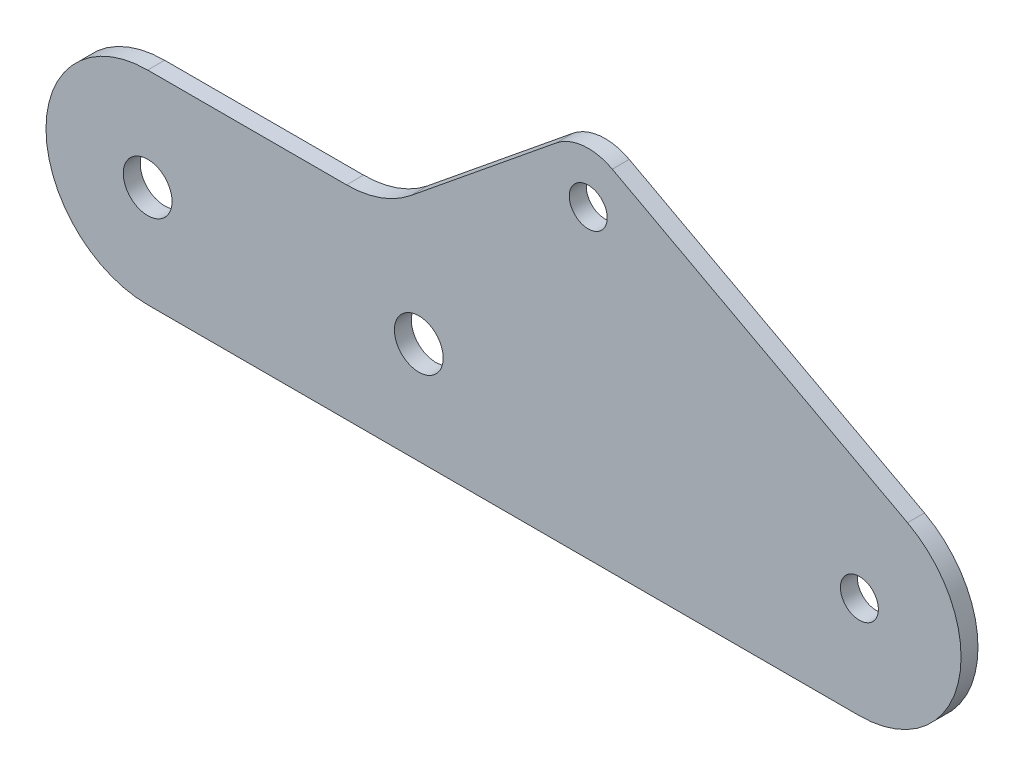
from build123d import *

# Parameters (mm, degrees)
SKETCH1_R           = 2.286
SKETCH1_R_2         = 1.778
BOSS_EXTRUDE1_DEPTH = 1.5875


with BuildPart() as part:
    # Sketch1 → Boss-Extrude1 (new body)
    with BuildSketch(Plane.XY):
        with BuildLine():
            Line((-3.929505469, -9.525), (41.275, -9.525))
            ThreePointArc((41.275, -9.525), (50.512160149, -2.323897025), (45.782340471, 8.391037295))
            Line((45.782340471, 8.391037295), (18.128670235, 23.245518647))
            ThreePointArc((18.128670235, 23.245518647), (15.423552826, 23.791054914), (12.870008564, 22.74478453))
            Line((12.870008564, 22.74478453), (-0.758748469, 11.66043094))
            ThreePointArc((-0.758748469, 11.66043094), (-3.579689187, 10.074720888), (-6.76873134, 9.525))
            Line((-6.76873134, 9.525), (-25.4, 9.525))
            ThreePointArc((-25.4, 9.525), (-34.925, 0), (-25.4, -9.525))
            Line((-25.4, -9.525), (-3.929505469, -9.525))
        make_face()
        Circle(SKETCH1_R, mode=Mode.SUBTRACT)
        with Locations((41.275, 0)):
            Circle(SKETCH1_R_2, mode=Mode.SUBTRACT)
        with Locations((15.875, 19.05)):
            Circle(SKETCH1_R_2, mode=Mode.SUBTRACT)
        with Locations((-25.4, 0)):
            Circle(SKETCH1_R, mode=Mode.SUBTRACT)
    extrude(amount=BOSS_EXTRUDE1_DEPTH)


solid = part.part
